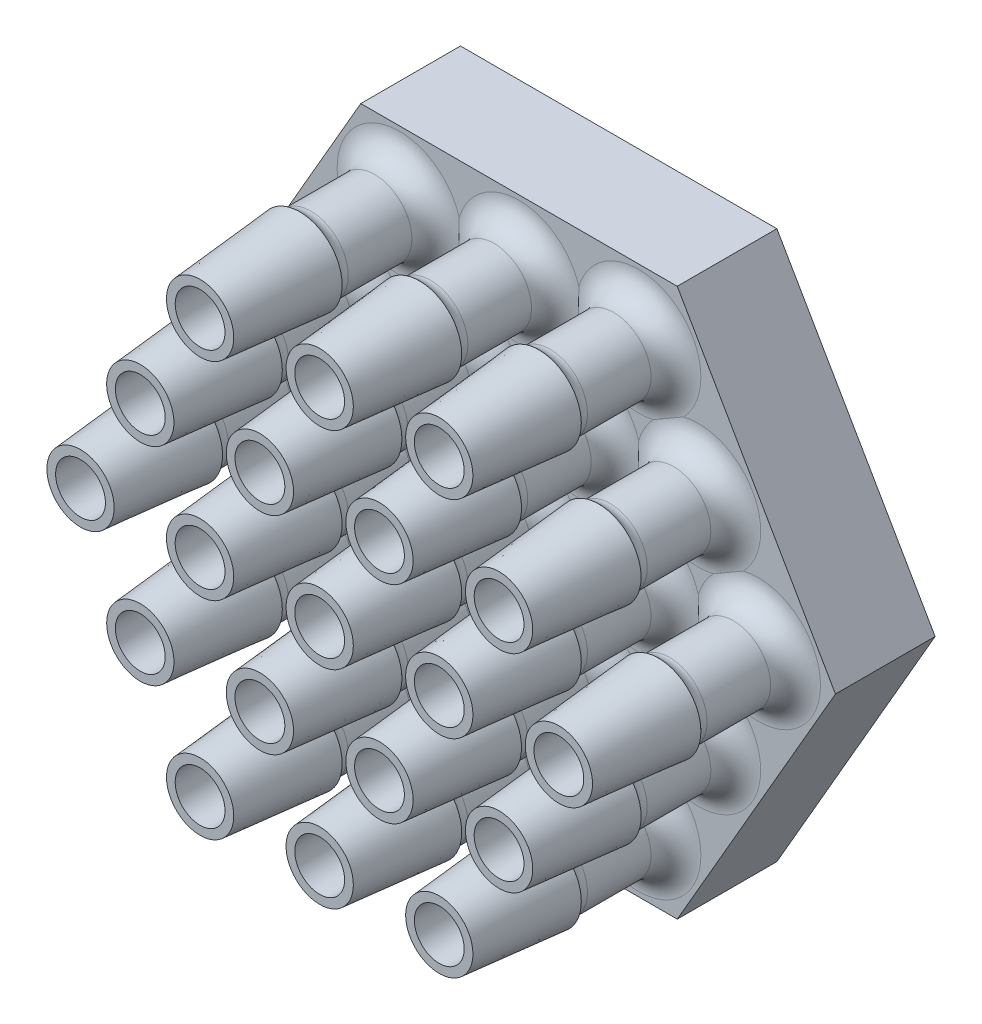
from build123d import *

# Parameters (mm, degrees)
SKETCH1_R               = 0.55
SKETCH1_R_2             = 0.5500000000000005
SKETCH1_R_3             = 0.5499999999999998
BOSS_EXTRUDE1_DEPTH     = 2
SKETCH2_R               = 0.75
BOSS_EXTRUDE2_DEPTH     = 2
SKETCH3_R               = 0.85
BOSS_EXTRUDE3_DEPTH     = 2
BOSS_EXTRUDE3_TAPER     = 5.0000000000000036
SKETCH4_R               = 0.5
CUT_EXTRUDE1_DEPTH      = 10.305016568138583
LPATTERN1_COUNT         = 3
LPATTERN1_PITCH         = 2.4
LPATTERN1_COUNT_DIR2    = 2
LPATTERN1_PITCH_DIR2    = 2.4
FILLET1_R               = 0.5
FILLET2_R               = 0.3
BOSS_EXTRUDE4_START     = 2
SKETCH5_R               = 0.55
SKETCH5_R_2             = 0.5
BOSS_EXTRUDE4_DEPTH     = 2
LPATTERN2_OUTLINE_R     = 0.55
LPATTERN2_OUTLINE_R_2   = 0.5
LPATTERN2_DEPTH         = 2
CIRPATTERN2_OUTLINE_R   = 0.55
CIRPATTERN2_OUTLINE_R_2 = 0.5
CIRPATTERN2_DEPTH       = 2


# Read off the part's stored shape, not the designer's step: CirPattern1, LPattern2, CirPattern2
with BuildPart() as part:
    # Sketch1 → Boss-Extrude1 (new body)
    with BuildSketch(Plane.XY):
        Polygon((6.35085296108588, 3.09e-14), (3.1754264805429124, 5.500000000000014), (-3.17542648054297, 5.4999999999999885), (-6.3508529610858835, -3.036e-14), (-3.175426480542914, -5.500000000000017), (3.1754264805429777, -5.5), align=None)
        Circle(SKETCH1_R, mode=Mode.SUBTRACT)
        with Locations((2.4, 0)):
            Circle(SKETCH1_R, mode=Mode.SUBTRACT)
        with Locations((4.8, -3.1e-16)):
            Circle(SKETCH1_R_2, mode=Mode.SUBTRACT)
        with Locations((-2.400000000000009, -1.676e-14)):
            Circle(SKETCH1_R, mode=Mode.SUBTRACT)
        with Locations((-4.8000000000000185, -3.352e-14)):
            Circle(SKETCH1_R_2, mode=Mode.SUBTRACT)
        with Locations((1.1999999999999997, 2.0784609690826064)):
            Circle(SKETCH1_R, mode=Mode.SUBTRACT)
        with Locations((3.5999999999999748, 2.0784609690826206)):
            Circle(SKETCH1_R_2, mode=Mode.SUBTRACT)
        with Locations((-1.200000000000038, 2.0784609690825966)):
            Circle(SKETCH1_R, mode=Mode.SUBTRACT)
        with Locations((-3.6000000000000476, 2.07846096908258)):
            Circle(SKETCH1_R, mode=Mode.SUBTRACT)
        with Locations((2.3999999999999497, 4.156921938165241)):
            Circle(SKETCH1_R, mode=Mode.SUBTRACT)
        with Locations((-6.679e-14, 4.156921938165211)):
            Circle(SKETCH1_R, mode=Mode.SUBTRACT)
        with Locations((-2.3999999999999617, 4.156921938165327)):
            Circle(SKETCH1_R, mode=Mode.SUBTRACT)
        with Locations((-1.2000000000000004, -2.078460969082698)):
            Circle(SKETCH1_R, mode=Mode.SUBTRACT)
        with Locations((1.2, -2.078460969082698)):
            Circle(SKETCH1_R_3, mode=Mode.SUBTRACT)
        with Locations((3.599999999999999, -2.078460969082698)):
            Circle(SKETCH1_R_2, mode=Mode.SUBTRACT)
        with Locations((-3.6000000000000085, -2.07846096908268)):
            Circle(SKETCH1_R, mode=Mode.SUBTRACT)
        with Locations((-2.400000000000001, -4.156921938165396)):
            Circle(SKETCH1_R, mode=Mode.SUBTRACT)
        with Locations((-5e-17, -4.156921938165396)):
            Circle(SKETCH1_R_3, mode=Mode.SUBTRACT)
        with Locations((2.4, -4.156921938165396)):
            Circle(SKETCH1_R, mode=Mode.SUBTRACT)
    extrude(amount=BOSS_EXTRUDE1_DEPTH)

    # Sketch2 → Boss-Extrude2 (add)
    with BuildSketch(Plane.XY.offset(2)):
        Circle(SKETCH2_R)
    boss_extrude2 = extrude(amount=BOSS_EXTRUDE2_DEPTH)

    # Sketch3 → Boss-Extrude3 (add)
    with BuildSketch(Plane.XY.offset(4)):
        Circle(SKETCH3_R)
    boss_extrude3 = extrude(amount=BOSS_EXTRUDE3_DEPTH, taper=BOSS_EXTRUDE3_TAPER)

    # Sketch4 → Cut-Extrude1 (cut, through all)
    with BuildSketch(Plane(origin=(0, 0, 2), x_dir=(-1, 0, 0), z_dir=(0, 0, -1))):
        Circle(SKETCH4_R)
    cut_extrude1 = extrude(amount=-CUT_EXTRUDE1_DEPTH, mode=Mode.SUBTRACT)

    # LPattern1: Boss-Extrude2, Boss-Extrude3, Cut-Extrude1 3 × 2, 2 skipped
    with Locations(*[Vector(1, 4.1e-15, 0) * (i * LPATTERN1_PITCH) + Vector(-0.5000000000000042, 0.8660254037844363, 0) * (j * LPATTERN1_PITCH_DIR2) for i in range(LPATTERN1_COUNT) for j in range(LPATTERN1_COUNT_DIR2) if (i, j) not in ((0, 0), (0, 1), (1, 1))]):
        add(boss_extrude2)
        add(boss_extrude3)
        add(cut_extrude1, mode=Mode.SUBTRACT)

    # CirPattern1 outline → CirPattern1 (revolve)
    with BuildSketch(Plane(origin=(1.2, 2.078460969, 0), x_dir=(1, 0, 0), z_dir=(0, -1, 0))):
        Polygon((0.5, 6), (0.5, 2), (0.75, 2), (0.75, 4), (0.85, 4), (0.675022673, 6), align=None)
    revolve(axis=Axis((1.2, 2.078460969, 0), (0, 0, 1)))

    # CirPattern1 2 outline → CirPattern1 2 (revolve)
    with BuildSketch(Plane(origin=(2.4, 4.156921938, 0), x_dir=(1, 0, 0), z_dir=(0, -1, 0))):
        Polygon((0.5, 6), (0.5, 2), (0.75, 2), (0.75, 4), (0.85, 4), (0.675022673, 6), align=None)
    revolve(axis=Axis((2.4, 4.156921938, 0), (0, 0, 1)))

    # CirPattern1 3 outline → CirPattern1 3 (revolve)
    with BuildSketch(Plane.XZ.offset(-4.156921938)):
        Polygon((0.5, 6), (0.5, 2), (0.75, 2), (0.75, 4), (0.85, 4), (0.675022673, 6), align=None)
    revolve(axis=Axis((0, 4.156921938, 0), (0, 0, 1)))

    # CirPattern1 4 outline → CirPattern1 4 (revolve)
    with BuildSketch(Plane(origin=(-1.2, 2.078460969, 0), x_dir=(1, 0, 0), z_dir=(0, -1, 0))):
        Polygon((0.5, 6), (0.5, 2), (0.75, 2), (0.75, 4), (0.85, 4), (0.675022673, 6), align=None)
    revolve(axis=Axis((-1.2, 2.078460969, 0), (0, 0, 1)))

    # CirPattern1 5 outline → CirPattern1 5 (revolve)
    with BuildSketch(Plane(origin=(-2.4, 4.156921938, 0), x_dir=(1, 0, 0), z_dir=(0, -1, 0))):
        Polygon((0.5, 6), (0.5, 2), (0.75, 2), (0.75, 4), (0.85, 4), (0.675022673, 6), align=None)
    revolve(axis=Axis((-2.4, 4.156921938, 0), (0, 0, 1)))

    # CirPattern1 6 outline → CirPattern1 6 (revolve)
    with BuildSketch(Plane(origin=(-3.6, 2.078460969, 0), x_dir=(1, 0, 0), z_dir=(0, -1, 0))):
        Polygon((0.5, 6), (0.5, 2), (0.75, 2), (0.75, 4), (0.85, 4), (0.675022673, 6), align=None)
    revolve(axis=Axis((-3.6, 2.078460969, 0), (0, 0, 1)))

    # CirPattern1 7 outline → CirPattern1 7 (revolve)
    with BuildSketch(Plane(origin=(-2.4, 0, 0), x_dir=(1, 0, 0), z_dir=(0, -1, 0))):
        Polygon((0.5, 6), (0.5, 2), (0.75, 2), (0.75, 4), (0.85, 4), (0.675022673, 6), align=None)
    revolve(axis=Axis((-2.4, 0, 0), (0, 0, 1)))

    # CirPattern1 8 outline → CirPattern1 8 (revolve)
    with BuildSketch(Plane(origin=(-4.8, 0, 0), x_dir=(1, 0, 0), z_dir=(0, -1, 0))):
        Polygon((0.5, 6), (0.5, 2), (0.75, 2), (0.75, 4), (0.85, 4), (0.675022673, 6), align=None)
    revolve(axis=Axis((-4.8, 0, 0), (0, 0, 1)))

    # CirPattern1 9 outline → CirPattern1 9 (revolve)
    with BuildSketch(Plane(origin=(-3.6, -2.078460969, 0), x_dir=(1, 0, 0), z_dir=(0, -1, 0))):
        Polygon((0.5, 6), (0.5, 2), (0.75, 2), (0.75, 4), (0.85, 4), (0.675022673, 6), align=None)
    revolve(axis=Axis((-3.6, -2.078460969, 0), (0, 0, 1)))

    # CirPattern1 10 outline → CirPattern1 10 (revolve)
    with BuildSketch(Plane(origin=(-1.2, -2.078460969, 0), x_dir=(1, 0, 0), z_dir=(0, -1, 0))):
        Polygon((0.5, 6), (0.5, 2), (0.75, 2), (0.75, 4), (0.85, 4), (0.675022673, 6), align=None)
    revolve(axis=Axis((-1.2, -2.078460969, 0), (0, 0, 1)))

    # CirPattern1 11 outline → CirPattern1 11 (revolve)
    with BuildSketch(Plane(origin=(-2.4, -4.156921938, 0), x_dir=(1, 0, 0), z_dir=(0, -1, 0))):
        Polygon((0.5, 6), (0.5, 2), (0.75, 2), (0.75, 4), (0.85, 4), (0.675022673, 6), align=None)
    revolve(axis=Axis((-2.4, -4.156921938, 0), (0, 0, 1)))

    # CirPattern1 12 outline → CirPattern1 12 (revolve)
    with BuildSketch(Plane.XZ.offset(4.156921938)):
        Polygon((0.5, 6), (0.5, 2), (0.75, 2), (0.75, 4), (0.85, 4), (0.675022673, 6), align=None)
    revolve(axis=Axis((0, -4.156921938, 0), (0, 0, 1)))

    # CirPattern1 13 outline → CirPattern1 13 (revolve)
    with BuildSketch(Plane(origin=(1.2, -2.078460969, 0), x_dir=(1, 0, 0), z_dir=(0, -1, 0))):
        Polygon((0.5, 6), (0.5, 2), (0.75, 2), (0.75, 4), (0.85, 4), (0.675022673, 6), align=None)
    revolve(axis=Axis((1.2, -2.078460969, 0), (0, 0, 1)))

    # CirPattern1 14 outline → CirPattern1 14 (revolve)
    with BuildSketch(Plane(origin=(2.4, -4.156921938, 0), x_dir=(1, 0, 0), z_dir=(0, -1, 0))):
        Polygon((0.5, 6), (0.5, 2), (0.75, 2), (0.75, 4), (0.85, 4), (0.675022673, 6), align=None)
    revolve(axis=Axis((2.4, -4.156921938, 0), (0, 0, 1)))

    # CirPattern1 15 outline → CirPattern1 15 (revolve)
    with BuildSketch(Plane(origin=(3.6, -2.078460969, 0), x_dir=(1, 0, 0), z_dir=(0, -1, 0))):
        Polygon((0.5, 6), (0.5, 2), (0.75, 2), (0.75, 4), (0.85, 4), (0.675022673, 6), align=None)
    revolve(axis=Axis((3.6, -2.078460969, 0), (0, 0, 1)))

    # Fillet1
    # the kernel refuses this fillet: 0.5 mm, written as the material it adds along each edge
    with BuildSketch(Plane(origin=(0, 0, 2), x_dir=(1, 0, 0), z_dir=(0, -1, 0))) as fillet1_piece_1:
        with BuildLine():
            CenterArc((0.75 + FILLET1_R, FILLET1_R), FILLET1_R, 180, 90)
            Line((0.75, FILLET1_R), (0.75, 0))
            Line((0.75, 0), (0.75 + FILLET1_R, 0))
        make_face()
    revolve(axis=Axis((0, 0, 2), (0, 0, 1)))
    with BuildSketch(Plane(origin=(2.4, 9.83e-15, 2), x_dir=(1, 0, 0), z_dir=(0, -1, 0))) as fillet1_piece_2:
        with BuildLine():
            CenterArc((0.75 + FILLET1_R, FILLET1_R), FILLET1_R, 180, 90)
            Line((0.75, FILLET1_R), (0.75, 0))
            Line((0.75, 0), (0.75 + FILLET1_R, 0))
        make_face()
    revolve(axis=Axis((2.4, 9.83e-15, 2), (0, 0, 1)))
    with BuildSketch(Plane(origin=(4.8, 1.967e-14, 2), x_dir=(1, 0, 0), z_dir=(0, -1, 0))) as fillet1_piece_3:
        with BuildLine():
            CenterArc((0.75 + FILLET1_R, FILLET1_R), FILLET1_R, 180, 90)
            Line((0.75, FILLET1_R), (0.75, 0))
            Line((0.75, 0), (0.75 + FILLET1_R, 0))
        make_face()
    revolve(axis=Axis((4.8, 1.967e-14, 2), (0, 0, 1)))
    with BuildSketch(Plane(origin=(3.59999999999999, 2.0784609690826663, 2), x_dir=(1, 0, 0), z_dir=(0, -1, 0))) as fillet1_piece_4:
        with BuildLine():
            CenterArc((0.75 + FILLET1_R, FILLET1_R), FILLET1_R, 180, 90)
            Line((0.75 + FILLET1_R, 0), (0.75, 0))
            Line((0.75, 0), (0.75, FILLET1_R))
        make_face()
    revolve(axis=Axis((3.59999999999999, 2.0784609690826663, 2), (0, 0, 1)))
    with BuildSketch(Plane(origin=(1.2, 2.078460969, 2), x_dir=(1, 0, 0), z_dir=(0, -1, 0))) as fillet1_piece_5:
        with BuildLine():
            CenterArc((0.75 + FILLET1_R, FILLET1_R), FILLET1_R, 180, 90)
            Line((0.7499999999999998, FILLET1_R), (0.75, 0))
            Line((0.75, 0), (0.75 + FILLET1_R, 0))
        make_face()
    revolve(axis=Axis((1.2, 2.078460969, 2), (0, 0, 1)))
    with BuildSketch(Plane(origin=(2.4, 4.156921938, 2), x_dir=(1, 0, 0), z_dir=(0, -1, 0))) as fillet1_piece_6:
        with BuildLine():
            CenterArc((0.75 + FILLET1_R, FILLET1_R), FILLET1_R, 180, 90)
            Line((0.75, FILLET1_R), (0.75, 0))
            Line((0.75, 0), (0.75 + FILLET1_R, 0))
        make_face()
    revolve(axis=Axis((2.4, 4.156921938, 2), (0, 0, 1)))
    with BuildSketch(Plane(origin=(0, 4.156921938, 2), x_dir=(1, 0, 0), z_dir=(0, -1, 0))) as fillet1_piece_7:
        with BuildLine():
            CenterArc((0.75 + FILLET1_R, FILLET1_R), FILLET1_R, 180, 90)
            Line((0.75, FILLET1_R), (0.75, 0))
            Line((0.75, 0), (0.75 + FILLET1_R, 0))
        make_face()
    revolve(axis=Axis((0, 4.156921938, 2), (0, 0, 1)))
    with BuildSketch(Plane(origin=(-1.2, 2.078460969, 2), x_dir=(1, 0, 0), z_dir=(0, -1, 0))) as fillet1_piece_8:
        with BuildLine():
            CenterArc((0.75 + FILLET1_R, FILLET1_R), FILLET1_R, 180, 90)
            Line((0.75, FILLET1_R), (0.75, 0))
            Line((0.75, 0), (0.75 + FILLET1_R, 0))
        make_face()
    revolve(axis=Axis((-1.2, 2.078460969, 2), (0, 0, 1)))
    with BuildSketch(Plane(origin=(-2.4, 4.156921938, 2), x_dir=(1, 0, 0), z_dir=(0, -1, 0))) as fillet1_piece_9:
        with BuildLine():
            CenterArc((0.75 + FILLET1_R, FILLET1_R), FILLET1_R, 180, 90)
            Line((0.75, FILLET1_R), (0.75, 0))
            Line((0.75, 0), (0.75 + FILLET1_R, 0))
        make_face()
    revolve(axis=Axis((-2.4, 4.156921938, 2), (0, 0, 1)))
    with BuildSketch(Plane(origin=(-3.6, 2.078460969, 2), x_dir=(1, 0, 0), z_dir=(0, -1, 0))) as fillet1_piece_10:
        with BuildLine():
            CenterArc((0.75 + FILLET1_R, FILLET1_R), FILLET1_R, 180, 90)
            Line((0.75, FILLET1_R), (0.75, 0))
            Line((0.75, 0), (0.75 + FILLET1_R, 0))
        make_face()
    revolve(axis=Axis((-3.6, 2.078460969, 2), (0, 0, 1)))
    with BuildSketch(Plane(origin=(-2.4, 0, 2), x_dir=(1, 0, 0), z_dir=(0, -1, 0))) as fillet1_piece_11:
        with BuildLine():
            CenterArc((0.75 + FILLET1_R, FILLET1_R), FILLET1_R, 180, 90)
            Line((0.75, FILLET1_R), (0.75, 0))
            Line((0.75, 0), (0.75 + FILLET1_R, 0))
        make_face()
    revolve(axis=Axis((-2.4, 0, 2), (0, 0, 1)))
    with BuildSketch(Plane(origin=(-4.8, 0, 2), x_dir=(1, 0, 0), z_dir=(0, -1, 0))) as fillet1_piece_12:
        with BuildLine():
            CenterArc((0.75 + FILLET1_R, FILLET1_R), FILLET1_R, 180, 90)
            Line((0.75, FILLET1_R), (0.75, 0))
            Line((0.75, 0), (0.75 + FILLET1_R, 0))
        make_face()
    revolve(axis=Axis((-4.8, 0, 2), (0, 0, 1)))
    with BuildSketch(Plane(origin=(-3.6, -2.078460969, 2), x_dir=(1, 0, 0), z_dir=(0, -1, 0))) as fillet1_piece_13:
        with BuildLine():
            CenterArc((0.75 + FILLET1_R, FILLET1_R), FILLET1_R, 180, 90)
            Line((0.75, FILLET1_R), (0.75, 0))
            Line((0.75, 0), (0.75 + FILLET1_R, 0))
        make_face()
    revolve(axis=Axis((-3.6, -2.078460969, 2), (0, 0, 1)))
    with BuildSketch(Plane(origin=(-1.2, -2.078460969, 2), x_dir=(1, 0, 0), z_dir=(0, -1, 0))) as fillet1_piece_14:
        with BuildLine():
            CenterArc((0.75 + FILLET1_R, FILLET1_R), FILLET1_R, 180, 90)
            Line((0.75, FILLET1_R), (0.75, 0))
            Line((0.75, 0), (0.75 + FILLET1_R, 0))
        make_face()
    revolve(axis=Axis((-1.2, -2.078460969, 2), (0, 0, 1)))
    with BuildSketch(Plane(origin=(-2.4, -4.156921938, 2), x_dir=(1, 0, 0), z_dir=(0, -1, 0))) as fillet1_piece_15:
        with BuildLine():
            CenterArc((0.75 + FILLET1_R, FILLET1_R), FILLET1_R, 180, 90)
            Line((0.75, FILLET1_R), (0.75, 0))
            Line((0.75, 0), (0.75 + FILLET1_R, 0))
        make_face()
    revolve(axis=Axis((-2.4, -4.156921938, 2), (0, 0, 1)))
    with BuildSketch(Plane(origin=(0, -4.156921938, 2), x_dir=(1, 0, 0), z_dir=(0, -1, 0))) as fillet1_piece_16:
        with BuildLine():
            CenterArc((0.75 + FILLET1_R, FILLET1_R), FILLET1_R, 180, 90)
            Line((0.75, FILLET1_R), (0.75, 0))
            Line((0.75, 0), (0.75 + FILLET1_R, 0))
        make_face()
    revolve(axis=Axis((0, -4.156921938, 2), (0, 0, 1)))
    with BuildSketch(Plane(origin=(1.2, -2.078460969, 2), x_dir=(1, 0, 0), z_dir=(0, -1, 0))) as fillet1_piece_17:
        with BuildLine():
            CenterArc((0.75 + FILLET1_R, FILLET1_R), FILLET1_R, 180, 90)
            Line((0.7499999999999998, FILLET1_R), (0.75, 0))
            Line((0.75, 0), (0.75 + FILLET1_R, 0))
        make_face()
    revolve(axis=Axis((1.2, -2.078460969, 2), (0, 0, 1)))
    with BuildSketch(Plane(origin=(2.4, -4.156921938, 2), x_dir=(1, 0, 0), z_dir=(0, -1, 0))) as fillet1_piece_18:
        with BuildLine():
            CenterArc((0.75 + FILLET1_R, FILLET1_R), FILLET1_R, 180, 90)
            Line((0.75, FILLET1_R), (0.75, 0))
            Line((0.75, 0), (0.75 + FILLET1_R, 0))
        make_face()
    revolve(axis=Axis((2.4, -4.156921938, 2), (0, 0, 1)))
    with BuildSketch(Plane(origin=(3.6, -2.078460969, 2), x_dir=(1, 0, 0), z_dir=(0, -1, 0))) as fillet1_piece_19:
        with BuildLine():
            CenterArc((0.7499999999999996 + FILLET1_R, FILLET1_R), FILLET1_R, 180, 90)
            Line((0.7499999999999996, FILLET1_R), (0.7499999999999996, 0))
            Line((0.7499999999999996, 0), (0.7499999999999996 + FILLET1_R, 0))
        make_face()
    revolve(axis=Axis((3.6, -2.078460969, 2), (0, 0, 1)))

    # Fillet2
    # the kernel refuses this fillet: 0.3 mm, written as the material it adds along each edge
    with BuildSketch(Plane(origin=(0, 0, 4), x_dir=(1, 0, 0), z_dir=(0, -1, 0))) as fillet2_piece_1:
        with BuildLine():
            CenterArc((1.05, -0.22360679774997916), FILLET2_R, 131.81031489577856, 48.18968510422144)
            Line((0.8500000000000002, 0), (0.8460000000000002, 0.00447213595499996))
            ThreePointArc((0.8460000000000002, 0.00447213595499996), (0.8, 0.00600000000000023), (0.75, 0.00600000000000023))
            Line((0.75, 0.00600000000000023), (0.744, 0))
            Line((0.744, 0), (0.744, -0.22360679774997916))
            Line((0.744, -0.22360679774997916), (0.75, -0.22360679774997916))
        make_face()
    revolve(axis=Axis((0, 0, 4), (0, 0, 1)))
    with BuildSketch(Plane(origin=(2.4, 9.83e-15, 4), x_dir=(1, 0, 0), z_dir=(0, -1, 0))) as fillet2_piece_2:
        with BuildLine():
            CenterArc((1.0499999999999998, -0.22360679774997916), FILLET2_R, 131.81031489577853, 48.18968510422144)
            Line((0.8500000000000001, 0), (0.8460000000000001, 0.00447213595499996))
            ThreePointArc((0.8460000000000001, 0.00447213595499996), (0.8000000000000003, 0.00600000000000023), (0.75, 0.00600000000000023))
            Line((0.75, 0.00600000000000023), (0.7440000000000002, 0))
            Line((0.7440000000000002, 0), (0.7440000000000002, -0.22360679774997916))
            Line((0.7440000000000002, -0.22360679774997916), (0.75, -0.22360679774997916))
        make_face()
    revolve(axis=Axis((2.4, 9.83e-15, 4), (0, 0, 1)))
    with BuildSketch(Plane(origin=(4.8, 1.967e-14, 4), x_dir=(1, 0, 0), z_dir=(0, -1, 0))) as fillet2_piece_3:
        with BuildLine():
            CenterArc((1.0499999999999998, -0.2236067977499796), FILLET2_R, 131.81031489577842, 48.18968510422155)
            Line((0.8500000000000005, 0), (0.846000000000001, 0.00447213595499996))
            ThreePointArc((0.846000000000001, 0.00447213595499996), (0.7999999999999998, 0.00600000000000023), (0.75, 0.00600000000000023))
            Line((0.75, 0.00600000000000023), (0.7439999999999998, 0))
            Line((0.7439999999999998, 0), (0.7439999999999998, -0.2236067977499796))
            Line((0.7439999999999998, -0.2236067977499796), (0.75, -0.2236067977499796))
        make_face()
    revolve(axis=Axis((4.8, 1.967e-14, 4), (0, 0, 1)))
    with BuildSketch(Plane(origin=(3.59999999999999, 2.0784609690826663, 4), x_dir=(1, 0, 0), z_dir=(0, -1, 0))) as fillet2_piece_4:
        with BuildLine():
            CenterArc((1.0499999999999998, -0.2236067977499796), FILLET2_R, 131.81031489577842, 48.18968510422155)
            Line((0.8500000000000005, 0), (0.846000000000001, 0.00447213595499996))
            ThreePointArc((0.846000000000001, 0.00447213595499996), (0.7999999999999998, 0.00600000000000023), (0.75, 0.00600000000000023))
            Line((0.75, 0.00600000000000023), (0.7439999999999998, 0))
            Line((0.7439999999999998, 0), (0.7439999999999998, -0.2236067977499796))
            Line((0.7439999999999998, -0.2236067977499796), (0.75, -0.2236067977499796))
        make_face()
    revolve(axis=Axis((3.59999999999999, 2.0784609690826663, 4), (0, 0, 1)))
    with BuildSketch(Plane(origin=(1.2, 2.078460969, 4), x_dir=(1, 0, 0), z_dir=(0, -1, 0))) as fillet2_piece_5:
        with BuildLine():
            CenterArc((1.05, -0.22360679774997827), FILLET2_R, 131.8103148957788, 48.18968510422121)
            Line((0.8499999999999994, 0), (0.8459999999999994, 0.00447213595499996))
            ThreePointArc((0.8459999999999994, 0.00447213595499996), (0.7999999999999996, 0.00600000000000023), (0.75, 0.00600000000000023))
            Line((0.75, 0.00600000000000023), (0.744, 0))
            Line((0.744, 0), (0.744, -0.22360679774997827))
            Line((0.744, -0.22360679774997827), (0.75, -0.22360679774997827))
        make_face()
    revolve(axis=Axis((1.2, 2.078460969, 4), (0, 0, 1)))
    with BuildSketch(Plane(origin=(2.4, 4.156921938, 4), x_dir=(1, 0, 0), z_dir=(0, -1, 0))) as fillet2_piece_6:
        with BuildLine():
            CenterArc((1.0499999999999998, -0.22360679774997916), FILLET2_R, 131.81031489577853, 48.18968510422144)
            Line((0.8500000000000001, 0), (0.8460000000000001, 0.00447213595499996))
            ThreePointArc((0.8460000000000001, 0.00447213595499996), (0.8000000000000003, 0.00600000000000023), (0.75, 0.00600000000000023))
            Line((0.75, 0.00600000000000023), (0.7440000000000002, 0))
            Line((0.7440000000000002, 0), (0.7440000000000002, -0.22360679774997916))
            Line((0.7440000000000002, -0.22360679774997916), (0.75, -0.22360679774997916))
        make_face()
    revolve(axis=Axis((2.4, 4.156921938, 4), (0, 0, 1)))
    with BuildSketch(Plane(origin=(0, 4.156921938, 4), x_dir=(1, 0, 0), z_dir=(0, -1, 0))) as fillet2_piece_7:
        with BuildLine():
            CenterArc((1.05, -0.22360679774997871), FILLET2_R, 131.81031489577867, 48.189685104221326)
            Line((0.8499999999999999, 0), (0.8459999999999999, 0.00447213595499996))
            ThreePointArc((0.8459999999999999, 0.00447213595499996), (0.7999999999999999, 0.00600000000000023), (0.75, 0.00600000000000023))
            Line((0.75, 0.00600000000000023), (0.744, 0))
            Line((0.744, 0), (0.744, -0.22360679774997871))
            Line((0.744, -0.22360679774997871), (0.75, -0.22360679774997871))
        make_face()
    revolve(axis=Axis((0, 4.156921938, 4), (0, 0, 1)))
    with BuildSketch(Plane(origin=(-1.2, 2.078460969, 4), x_dir=(1, 0, 0), z_dir=(0, -1, 0))) as fillet2_piece_8:
        with BuildLine():
            CenterArc((1.05, -0.22360679774997916), FILLET2_R, 131.8103148957786, 48.18968510422144)
            Line((0.8500000000000001, 0), (0.8460000000000001, 0.00447213595499996))
            ThreePointArc((0.8460000000000001, 0.00447213595499996), (0.8, 0.00600000000000023), (0.75, 0.00600000000000023))
            Line((0.75, 0.00600000000000023), (0.744, 0))
            Line((0.744, 0), (0.744, -0.22360679774997916))
            Line((0.744, -0.22360679774997916), (0.75, -0.22360679774997916))
        make_face()
    revolve(axis=Axis((-1.2, 2.078460969, 4), (0, 0, 1)))
    with BuildSketch(Plane(origin=(-2.4, 4.156921938, 4), x_dir=(1, 0, 0), z_dir=(0, -1, 0))) as fillet2_piece_9:
        with BuildLine():
            CenterArc((1.05, -0.22360679774997916), FILLET2_R, 131.8103148957786, 48.18968510422144)
            Line((0.8500000000000001, 0), (0.8460000000000001, 0.00447213595499996))
            ThreePointArc((0.8460000000000001, 0.00447213595499996), (0.8, 0.00600000000000023), (0.75, 0.00600000000000023))
            Line((0.75, 0.00600000000000023), (0.744, 0))
            Line((0.744, 0), (0.744, -0.22360679774997916))
            Line((0.744, -0.22360679774997916), (0.75, -0.22360679774997916))
        make_face()
    revolve(axis=Axis((-2.4, 4.156921938, 4), (0, 0, 1)))
    with BuildSketch(Plane(origin=(-3.6, 2.078460969, 4), x_dir=(1, 0, 0), z_dir=(0, -1, 0))) as fillet2_piece_10:
        with BuildLine():
            CenterArc((1.0499999999999998, -0.22360679774997916), FILLET2_R, 131.81031489577853, 48.18968510422144)
            Line((0.8500000000000001, 0), (0.8460000000000001, 0.00447213595499996))
            ThreePointArc((0.8460000000000001, 0.00447213595499996), (0.8000000000000003, 0.00600000000000023), (0.75, 0.00600000000000023))
            Line((0.75, 0.00600000000000023), (0.7440000000000002, 0))
            Line((0.7440000000000002, 0), (0.7440000000000002, -0.22360679774997916))
            Line((0.7440000000000002, -0.22360679774997916), (0.75, -0.22360679774997916))
        make_face()
    revolve(axis=Axis((-3.6, 2.078460969, 4), (0, 0, 1)))
    with BuildSketch(Plane(origin=(-2.4, 0, 4), x_dir=(1, 0, 0), z_dir=(0, -1, 0))) as fillet2_piece_11:
        with BuildLine():
            CenterArc((1.05, -0.22360679774997916), FILLET2_R, 131.8103148957786, 48.18968510422144)
            Line((0.8500000000000001, 0), (0.8460000000000001, 0.00447213595499996))
            ThreePointArc((0.8460000000000001, 0.00447213595499996), (0.8, 0.00600000000000023), (0.75, 0.00600000000000023))
            Line((0.75, 0.00600000000000023), (0.744, 0))
            Line((0.744, 0), (0.744, -0.22360679774997916))
            Line((0.744, -0.22360679774997916), (0.75, -0.22360679774997916))
        make_face()
    revolve(axis=Axis((-2.4, 0, 4), (0, 0, 1)))
    with BuildSketch(Plane(origin=(-4.8, 0, 4), x_dir=(1, 0, 0), z_dir=(0, -1, 0))) as fillet2_piece_12:
        with BuildLine():
            CenterArc((1.0499999999999998, -0.22360679774997916), FILLET2_R, 131.81031489577853, 48.18968510422144)
            Line((0.8500000000000001, 0), (0.8460000000000001, 0.00447213595499996))
            ThreePointArc((0.8460000000000001, 0.00447213595499996), (0.7999999999999998, 0.00600000000000023), (0.75, 0.00600000000000023))
            Line((0.75, 0.00600000000000023), (0.7439999999999998, 0))
            Line((0.7439999999999998, 0), (0.7439999999999998, -0.22360679774997916))
            Line((0.7439999999999998, -0.22360679774997916), (0.75, -0.22360679774997916))
        make_face()
    revolve(axis=Axis((-4.8, 0, 4), (0, 0, 1)))
    with BuildSketch(Plane(origin=(-3.6, -2.078460969, 4), x_dir=(1, 0, 0), z_dir=(0, -1, 0))) as fillet2_piece_13:
        with BuildLine():
            CenterArc((1.0499999999999998, -0.22360679774997916), FILLET2_R, 131.81031489577853, 48.18968510422144)
            Line((0.8500000000000001, 0), (0.8460000000000001, 0.00447213595499996))
            ThreePointArc((0.8460000000000001, 0.00447213595499996), (0.8000000000000003, 0.00600000000000023), (0.75, 0.00600000000000023))
            Line((0.75, 0.00600000000000023), (0.7440000000000002, 0))
            Line((0.7440000000000002, 0), (0.7440000000000002, -0.22360679774997916))
            Line((0.7440000000000002, -0.22360679774997916), (0.75, -0.22360679774997916))
        make_face()
    revolve(axis=Axis((-3.6, -2.078460969, 4), (0, 0, 1)))
    with BuildSketch(Plane(origin=(-1.2, -2.078460969, 4), x_dir=(1, 0, 0), z_dir=(0, -1, 0))) as fillet2_piece_14:
        with BuildLine():
            CenterArc((1.05, -0.22360679774997916), FILLET2_R, 131.8103148957786, 48.18968510422144)
            Line((0.8500000000000001, 0), (0.8460000000000001, 0.00447213595499996))
            ThreePointArc((0.8460000000000001, 0.00447213595499996), (0.8, 0.00600000000000023), (0.75, 0.00600000000000023))
            Line((0.75, 0.00600000000000023), (0.744, 0))
            Line((0.744, 0), (0.744, -0.22360679774997916))
            Line((0.744, -0.22360679774997916), (0.75, -0.22360679774997916))
        make_face()
    revolve(axis=Axis((-1.2, -2.078460969, 4), (0, 0, 1)))
    with BuildSketch(Plane(origin=(-2.4, -4.156921938, 4), x_dir=(1, 0, 0), z_dir=(0, -1, 0))) as fillet2_piece_15:
        with BuildLine():
            CenterArc((1.05, -0.22360679774997916), FILLET2_R, 131.8103148957786, 48.18968510422144)
            Line((0.8500000000000001, 0), (0.8460000000000001, 0.00447213595499996))
            ThreePointArc((0.8460000000000001, 0.00447213595499996), (0.8, 0.00600000000000023), (0.75, 0.00600000000000023))
            Line((0.75, 0.00600000000000023), (0.744, 0))
            Line((0.744, 0), (0.744, -0.22360679774997916))
            Line((0.744, -0.22360679774997916), (0.75, -0.22360679774997916))
        make_face()
    revolve(axis=Axis((-2.4, -4.156921938, 4), (0, 0, 1)))
    with BuildSketch(Plane(origin=(0, -4.156921938, 4), x_dir=(1, 0, 0), z_dir=(0, -1, 0))) as fillet2_piece_16:
        with BuildLine():
            CenterArc((1.05, -0.22360679774997871), FILLET2_R, 131.81031489577867, 48.189685104221326)
            Line((0.8499999999999999, 0), (0.8459999999999999, 0.00447213595499996))
            ThreePointArc((0.8459999999999999, 0.00447213595499996), (0.7999999999999999, 0.00600000000000023), (0.75, 0.00600000000000023))
            Line((0.75, 0.00600000000000023), (0.744, 0))
            Line((0.744, 0), (0.744, -0.22360679774997871))
            Line((0.744, -0.22360679774997871), (0.75, -0.22360679774997871))
        make_face()
    revolve(axis=Axis((0, -4.156921938, 4), (0, 0, 1)))
    with BuildSketch(Plane(origin=(1.2, -2.078460969, 4), x_dir=(1, 0, 0), z_dir=(0, -1, 0))) as fillet2_piece_17:
        with BuildLine():
            CenterArc((1.05, -0.22360679774997827), FILLET2_R, 131.8103148957788, 48.18968510422121)
            Line((0.8499999999999994, 0), (0.8459999999999994, 0.00447213595499996))
            ThreePointArc((0.8459999999999994, 0.00447213595499996), (0.7999999999999996, 0.00600000000000023), (0.75, 0.00600000000000023))
            Line((0.75, 0.00600000000000023), (0.744, 0))
            Line((0.744, 0), (0.744, -0.22360679774997827))
            Line((0.744, -0.22360679774997827), (0.75, -0.22360679774997827))
        make_face()
    revolve(axis=Axis((1.2, -2.078460969, 4), (0, 0, 1)))
    with BuildSketch(Plane(origin=(2.4, -4.156921938, 4), x_dir=(1, 0, 0), z_dir=(0, -1, 0))) as fillet2_piece_18:
        with BuildLine():
            CenterArc((1.0499999999999998, -0.22360679774997916), FILLET2_R, 131.81031489577853, 48.18968510422144)
            Line((0.8500000000000001, 0), (0.8460000000000001, 0.00447213595499996))
            ThreePointArc((0.8460000000000001, 0.00447213595499996), (0.8000000000000003, 0.00600000000000023), (0.75, 0.00600000000000023))
            Line((0.75, 0.00600000000000023), (0.7440000000000002, 0))
            Line((0.7440000000000002, 0), (0.7440000000000002, -0.22360679774997916))
            Line((0.7440000000000002, -0.22360679774997916), (0.75, -0.22360679774997916))
        make_face()
    revolve(axis=Axis((2.4, -4.156921938, 4), (0, 0, 1)))
    with BuildSketch(Plane(origin=(3.6, -2.078460969, 4), x_dir=(1, 0, 0), z_dir=(0, -1, 0))) as fillet2_piece_19:
        with BuildLine():
            CenterArc((1.0499999999999994, -0.2236067977499796), FILLET2_R, 131.81031489577842, 48.18968510422155)
            Line((0.8500000000000001, 0), (0.8460000000000005, 0.00447213595499996))
            ThreePointArc((0.8460000000000005, 0.00447213595499996), (0.8000000000000003, 0.00600000000000023), (0.7499999999999996, 0.00600000000000023))
            Line((0.7499999999999996, 0.00600000000000023), (0.7439999999999993, 0))
            Line((0.7439999999999993, 0), (0.7439999999999993, -0.2236067977499796))
            Line((0.7439999999999993, -0.2236067977499796), (0.7499999999999996, -0.2236067977499796))
        make_face()
    revolve(axis=Axis((3.6, -2.078460969, 4), (0, 0, 1)))

    # Sketch5 → Boss-Extrude4 (add)
    with BuildSketch(Plane(origin=(0, 0, 2), x_dir=(-1, 0, 0), z_dir=(0, 0, -1)).offset(BOSS_EXTRUDE4_START)):
        Circle(SKETCH5_R)
        with Locations(Location((0, 0, 0), (0, 0, 60))):
            Circle(SKETCH5_R_2, mode=Mode.SUBTRACT)
    extrude(amount=-BOSS_EXTRUDE4_DEPTH)

    # LPattern2 outline → LPattern2 (add)
    # profile 1 of 3: a face of its own
    with BuildSketch(Plane.XY):
        with Locations((-1.2, -2.078460969)):
            Circle(LPATTERN2_OUTLINE_R)
        with Locations((-1.2, -2.078460969)):
            Circle(LPATTERN2_OUTLINE_R_2, mode=Mode.SUBTRACT)
    # profile 2 of 3: a face of its own
    with BuildSketch(Plane.XY):
        with Locations((-2.4, -4.156921938)):
            Circle(LPATTERN2_OUTLINE_R)
        with Locations((-2.4, -4.156921938)):
            Circle(LPATTERN2_OUTLINE_R_2, mode=Mode.SUBTRACT)
    # profile 3 of 3: a face of its own
    with BuildSketch(Plane.XY):
        with Locations((0, -4.156921938)):
            Circle(LPATTERN2_OUTLINE_R)
        with Locations((0, -4.156921938)):
            Circle(LPATTERN2_OUTLINE_R_2, mode=Mode.SUBTRACT)
    extrude(amount=LPATTERN2_DEPTH)

    # CirPattern2 outline → CirPattern2 (add)
    # profile 1 of 15: a face of its own
    with BuildSketch(Plane.XY):
        with Locations((2.4, 0)):
            Circle(CIRPATTERN2_OUTLINE_R)
        with Locations((2.4, 0)):
            Circle(CIRPATTERN2_OUTLINE_R_2, mode=Mode.SUBTRACT)
    # profile 2 of 15: a face of its own
    with BuildSketch(Plane.XY):
        with Locations((4.8, 0)):
            Circle(CIRPATTERN2_OUTLINE_R)
        with Locations((4.8, 0)):
            Circle(CIRPATTERN2_OUTLINE_R_2, mode=Mode.SUBTRACT)
    # profile 3 of 15: a face of its own
    with BuildSketch(Plane.XY):
        with Locations((-2.4, 0)):
            Circle(CIRPATTERN2_OUTLINE_R)
        with Locations((-2.4, 0)):
            Circle(CIRPATTERN2_OUTLINE_R_2, mode=Mode.SUBTRACT)
    # profile 4 of 15: a face of its own
    with BuildSketch(Plane.XY):
        with Locations((-4.8, 0)):
            Circle(CIRPATTERN2_OUTLINE_R)
        with Locations((-4.8, 0)):
            Circle(CIRPATTERN2_OUTLINE_R_2, mode=Mode.SUBTRACT)
    # profile 5 of 15: a face of its own
    with BuildSketch(Plane.XY):
        with Locations((1.2, 2.078460969)):
            Circle(CIRPATTERN2_OUTLINE_R)
        with Locations((1.2, 2.078460969)):
            Circle(CIRPATTERN2_OUTLINE_R_2, mode=Mode.SUBTRACT)
    # profile 6 of 15: a face of its own
    with BuildSketch(Plane.XY):
        with Locations((3.6, 2.078460969)):
            Circle(CIRPATTERN2_OUTLINE_R)
        with Locations((3.6, 2.078460969)):
            Circle(CIRPATTERN2_OUTLINE_R_2, mode=Mode.SUBTRACT)
    # profile 7 of 15: a face of its own
    with BuildSketch(Plane.XY):
        with Locations((-1.2, 2.078460969)):
            Circle(CIRPATTERN2_OUTLINE_R)
        with Locations((-1.2, 2.078460969)):
            Circle(CIRPATTERN2_OUTLINE_R_2, mode=Mode.SUBTRACT)
    # profile 8 of 15: a face of its own
    with BuildSketch(Plane.XY):
        with Locations((-3.6, 2.078460969)):
            Circle(CIRPATTERN2_OUTLINE_R)
        with Locations((-3.6, 2.078460969)):
            Circle(CIRPATTERN2_OUTLINE_R_2, mode=Mode.SUBTRACT)
    # profile 9 of 15: a face of its own
    with BuildSketch(Plane.XY):
        with Locations((2.4, 4.156921938)):
            Circle(CIRPATTERN2_OUTLINE_R)
        with Locations((2.4, 4.156921938)):
            Circle(CIRPATTERN2_OUTLINE_R_2, mode=Mode.SUBTRACT)
    # profile 10 of 15: a face of its own
    with BuildSketch(Plane.XY):
        with Locations((0, 4.156921938)):
            Circle(CIRPATTERN2_OUTLINE_R)
        with Locations((0, 4.156921938)):
            Circle(CIRPATTERN2_OUTLINE_R_2, mode=Mode.SUBTRACT)
    # profile 11 of 15: a face of its own
    with BuildSketch(Plane.XY):
        with Locations((-2.4, 4.156921938)):
            Circle(CIRPATTERN2_OUTLINE_R)
        with Locations((-2.4, 4.156921938)):
            Circle(CIRPATTERN2_OUTLINE_R_2, mode=Mode.SUBTRACT)
    # profile 12 of 15: a face of its own
    with BuildSketch(Plane.XY):
        with Locations((1.2, -2.078460969)):
            Circle(CIRPATTERN2_OUTLINE_R)
        with Locations((1.2, -2.078460969)):
            Circle(CIRPATTERN2_OUTLINE_R_2, mode=Mode.SUBTRACT)
    # profile 13 of 15: a face of its own
    with BuildSketch(Plane.XY):
        with Locations((3.6, -2.078460969)):
            Circle(CIRPATTERN2_OUTLINE_R)
        with Locations((3.6, -2.078460969)):
            Circle(CIRPATTERN2_OUTLINE_R_2, mode=Mode.SUBTRACT)
    # profile 14 of 15: a face of its own
    with BuildSketch(Plane.XY):
        with Locations((-3.6, -2.078460969)):
            Circle(CIRPATTERN2_OUTLINE_R)
        with Locations((-3.6, -2.078460969)):
            Circle(CIRPATTERN2_OUTLINE_R_2, mode=Mode.SUBTRACT)
    # profile 15 of 15: a face of its own
    with BuildSketch(Plane.XY):
        with Locations((2.4, -4.156921938)):
            Circle(CIRPATTERN2_OUTLINE_R)
        with Locations((2.4, -4.156921938)):
            Circle(CIRPATTERN2_OUTLINE_R_2, mode=Mode.SUBTRACT)
    extrude(amount=CIRPATTERN2_DEPTH)


solid = part.part
